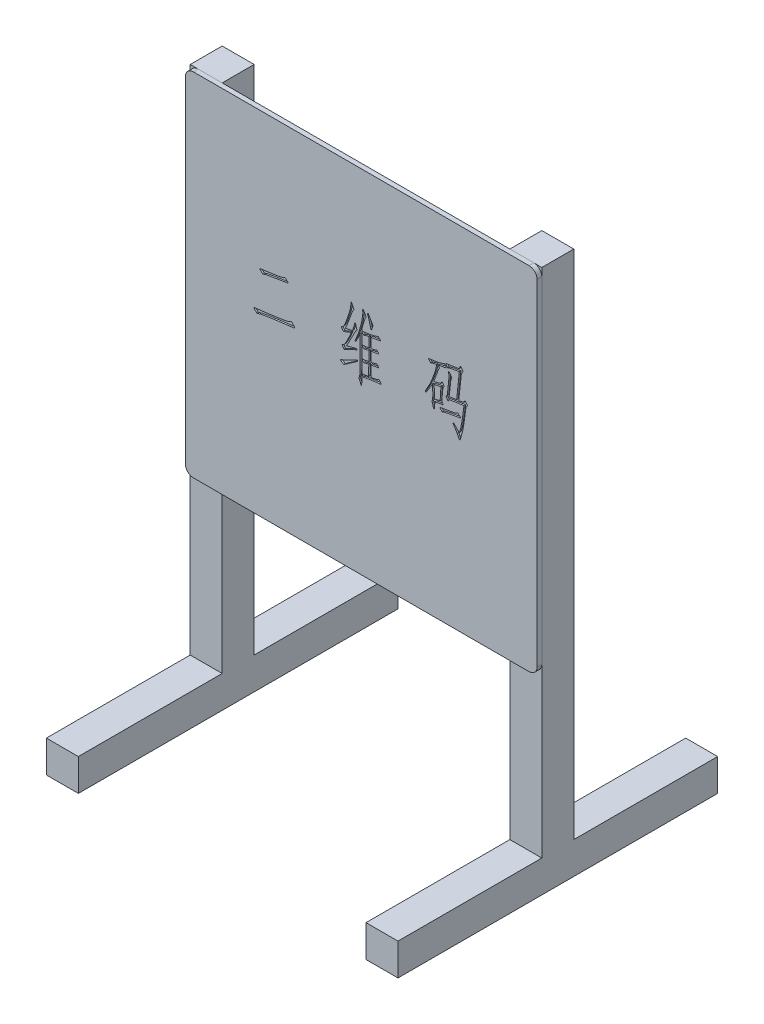
from build123d import *

# Parameters (mm, degrees)
SKETCH_1_W          = 20
SKETCH_1_H          = 20
EXTRUDE_1_DEPTH     = 200
SKETCH_2_W          = 20
SKETCH_2_H          = 20
EXTRUDE_2_DEPTH     = 320
SKETCH_3_W          = 220
SKETCH_3_H          = 220
EXTRUDE_3_DEPTH     = 3
FILLET_1_R          = 5
CUT_EXTRUDE_START   = 112
CUT_EXTRUDE_1_DEPTH = 2


with BuildPart() as part:
    # 草图1 → 凸台-拉伸1 (new body)
    with BuildSketch(Plane.XY):
        with Locations((10, 10)):
            Rectangle(SKETCH_1_W, SKETCH_1_H)
    extrude(amount=EXTRUDE_1_DEPTH)

    # 草图2 → 凸台-拉伸2 (add)
    with BuildSketch(Plane(origin=(0, 20, 0), x_dir=(1, 0, 0), z_dir=(0, 1, 0))):
        with Locations((10, -100)):
            Rectangle(SKETCH_2_W, SKETCH_2_H)
    extrude(amount=EXTRUDE_2_DEPTH)


with BuildPart() as body_2:
    # 草图3 → 凸台-拉伸3 (new body)
    with BuildSketch(Plane.XY.offset(110)):
        with Locations((110, 230)):
            Rectangle(SKETCH_3_W, SKETCH_3_H)
    extrude(amount=EXTRUDE_3_DEPTH)

    # 圆角1
    fillet_1_edges = [body_2.edges().sort_by_distance(p)[0] for p in [
        (0, 340, 111.5),
        (220, 340, 111.5),
        (220, 120, 111.5),
        (0, 120, 111.5),
    ]]
    fillet(fillet_1_edges, radius=FILLET_1_R)

    # 切除-拉伸1: read off the stored shape, not the designer's step
    # 切除-拉伸1 outline → 切除-拉伸1 (cut)
    # profile 1 of 9: a face of its own
    with BuildSketch(Plane.XY.offset(CUT_EXTRUDE_START)):
        with BuildLine():
            Line((55.311740891, 231.09833795), (65.008310249, 232.372150011))
            Line((65.008310249, 232.372150011), (68.121350948, 232.677604944))
            add(Edge.make_bspline(
                [(68.205838483, 233.379501385), (68.267214298, 233.298947041), (68.377007719, 233.154845703), (68.403497912, 232.910428774), (68.31595679, 232.701907335), (68.186205936, 232.685704039), (68.121350948, 232.677604944)],
                knots=[0, 0, 0, 0, 0.331218851, 0.592507827, 0.796318106, 1, 1, 1, 1], degree=3))
            Line((68.205838483, 233.379501385), (66.366609844, 235.264223311))
            add(Edge.make_bspline(
                [(53.953441296, 232.677604944), (54.546980826, 232.762364019), (55.673401803, 232.923220029), (57.27083702, 233.147092374), (58.682460929, 233.358592857), (59.91166994, 233.536917513), (60.955123106, 233.701872794), (61.814141641, 233.833887479), (62.484785098, 233.954036036), (63.141500558, 234.069450651), (63.848011705, 234.25340025), (64.67429026, 234.518041943), (65.51977604, 234.857954636), (66.079951533, 235.126698933), (66.366609844, 235.264223311)],
                knots=[0, 0, 0, 0, 0.141194071, 0.267958501, 0.379861519, 0.477335063, 0.560455941, 0.628644591, 0.681987937, 0.720911212, 0.785623776, 0.85370738, 0.925137754, 1, 1, 1, 1], degree=3))
            Line((53.953441296, 232.677604944), (46.75900277, 231.754741104))
            Line((46.75900277, 231.754741104), (44.73780098, 231.533773706))
            Line((44.73780098, 231.533773706), (43.113040699, 231.403792883))
            add(Edge.make_bspline(
                [(43.028553164, 230.747389729), (42.967212626, 230.813676422), (42.859052635, 230.930557824), (42.829990469, 231.159844066), (42.933016465, 231.339482502), (43.052135883, 231.382035746), (43.113040699, 231.403792883)],
                knots=[0, 0, 0, 0, 0.316797043, 0.558599032, 0.774315177, 1, 1, 1, 1], degree=3))
            Line((43.028553164, 230.747389729), (44.783294268, 229.07713616))
            add(Edge.make_bspline(
                [(55.311740891, 231.09833795), (54.674596678, 231.01339186), (53.455581601, 230.850868897), (51.713596986, 230.591265001), (50.142896385, 230.332618995), (48.741559365, 230.077119462), (47.50775402, 229.839217711), (46.447574029, 229.581951246), (45.553811758, 229.343216478), (45.022949765, 229.159895619), (44.783294268, 229.07713616)],
                knots=[0, 0, 0, 0, 0.179604664, 0.343628318, 0.492104165, 0.624372522, 0.741661642, 0.843114277, 0.929174576, 1, 1, 1, 1], degree=3))
        make_face()
    # profile 2 of 9: a face of its own
    with BuildSketch(Plane.XY.offset(CUT_EXTRUDE_START)):
        with BuildLine():
            Line((114.289367143, 263.821010015), (113.892925634, 263.431067547))
            Line((113.892925634, 263.431067547), (114.419347965, 261.981781377))
            Line((114.419347965, 261.981781377), (114.945770296, 260.181546985))
            Line((114.945770296, 260.181546985), (115.426699339, 258.556786704))
            Line((115.426699339, 258.556786704), (115.823140848, 256.97751971))
            Line((115.823140848, 256.97751971), (116.083102493, 255.794694225))
            add(Edge.make_bspline(
                [(116.655018112, 256.275623269), (116.626591021, 256.193711957), (116.57621048, 256.048542823), (116.514130688, 255.855343264), (116.440952703, 255.739312778), (116.365295868, 255.640031707), (116.209893934, 255.679096068), (116.131492965, 255.750575716), (116.083102493, 255.794694225)],
                knots=[0, 0, 0, 0, 0.259257877, 0.459475505, 0.595649689, 0.677811931, 0.801139795, 1, 1, 1, 1], degree=3))
            Line((116.655018112, 256.275623269), (117.181440443, 257.90038355))
            add(Edge.make_bspline(
                [(116.921478798, 259.525143831), (116.97721778, 259.412250092), (117.075832903, 259.212515015), (117.211720192, 258.954822778), (117.290407409, 258.765692505), (117.336757043, 258.628544429), (117.332950654, 258.501162233), (117.300361051, 258.348486155), (117.259222879, 258.140249036), (117.209375722, 257.986530365), (117.181440443, 257.90038355)],
                knots=[0, 0, 0, 0, 0.217917052, 0.385545554, 0.503184461, 0.573208245, 0.633180841, 0.720685488, 0.843466929, 1, 1, 1, 1], degree=3))
            Line((116.921478798, 259.525143831), (116.083102493, 260.928936714))
            Line((116.083102493, 260.928936714), (115.60217345, 261.676326444))
            Line((115.60217345, 261.676326444), (114.991263584, 262.729171106))
            Line((114.991263584, 262.729171106), (114.289367143, 263.821010015))
        make_face()
    # profile 3 of 9: a face of its own
    with BuildSketch(Plane.XY.offset(CUT_EXTRUDE_START)):
        with BuildLine():
            Line((150.799808225, 240.970381419), (150.058917537, 239.781056893))
            Line((150.058917537, 239.781056893), (150.448860004, 239.079160452))
            Line((150.448860004, 239.079160452), (151.066268911, 239.956531004))
            add(Edge.make_bspline(
                [(154.660238653, 245.88365651), (154.487187195, 245.573727115), (154.151439176, 244.9724136), (153.656224015, 244.09542135), (153.176565286, 243.276104254), (152.721824028, 242.504300253), (152.282228948, 241.791221307), (151.854171496, 241.135475615), (151.464910258, 240.521153723), (151.195571884, 240.139671556), (151.066268911, 239.956531004)],
                knots=[0, 0, 0, 0, 0.153559991, 0.297931398, 0.435681254, 0.564260234, 0.685455066, 0.798015817, 0.903032178, 1, 1, 1, 1], degree=3))
            Line((154.660238653, 245.88365651), (154.796718517, 239.605582783))
            Line((154.796718517, 239.605582783), (154.705731941, 238.422757298))
            add(Edge.make_bspline(
                [(154.621244407, 237.285425101), (154.628277552, 237.330858335), (154.647287712, 237.453661578), (154.661235041, 237.690677956), (154.691811182, 238.023644268), (154.700741333, 238.279674815), (154.705731941, 238.422757298)],
                knots=[0, 0, 0, 0, 0.120831814, 0.326600979, 0.623671454, 1, 1, 1, 1], degree=3))
            add(Edge.make_bspline(
                [(154.484764543, 235.48519071), (154.459275346, 235.561191717), (154.414832084, 235.693707963), (154.35347763, 235.857369087), (154.325668643, 235.961277749), (154.276050181, 236.02194154), (154.329326297, 236.148959212), (154.363387198, 236.380732888), (154.493304599, 236.780744662), (154.574057344, 237.099287669), (154.621244407, 237.285425101)],
                knots=[0, 0, 0, 0, 0.12798716, 0.22315991, 0.279043581, 0.299213499, 0.341295418, 0.473014495, 0.692061271, 1, 1, 1, 1], degree=3))
            Line((154.484764543, 235.48519071), (154.796718517, 234.432346047))
            Line((154.796718517, 234.432346047), (155.10217345, 233.424994673))
            add(Edge.make_bspline(
                [(155.979544002, 234.126891114), (155.970745125, 233.990082684), (155.954049492, 233.730492352), (155.899678091, 233.370330383), (155.809877602, 233.053076565), (155.725016723, 232.825679699), (155.583882529, 232.61502931), (155.361969527, 232.742171498), (155.249335565, 233.030912036), (155.158072727, 233.275303057), (155.10217345, 233.424994673)],
                knots=[0, 0, 0, 0, 0.164724541, 0.312560405, 0.439664693, 0.552949131, 0.626671498, 0.686222562, 0.807808604, 1, 1, 1, 1], degree=3))
            Line((155.979544002, 234.126891114), (156.02503729, 236.713509482))
            Line((156.02503729, 236.713509482), (158.085233326, 237.148945238))
            Line((158.085233326, 237.148945238), (159.313552099, 237.369912636))
            Line((159.313552099, 237.369912636), (161.068293203, 237.545386746))
            add(Edge.make_bspline(
                [(160.977306627, 238.422757298), (161.02722108, 238.342752282), (161.116642085, 238.199424475), (161.234298611, 238.007109549), (161.294322264, 237.850685838), (161.323183605, 237.708930078), (161.244013879, 237.560650399), (161.129999054, 237.550746711), (161.068293203, 237.545386746)],
                knots=[0, 0, 0, 0, 0.255446758, 0.457629097, 0.60792079, 0.708286671, 0.842122117, 1, 1, 1, 1], degree=3))
            Line((160.977306627, 238.422757298), (160.411890049, 239.170147027))
            Line((160.411890049, 239.170147027), (160.892819092, 244.78531856))
            add(Edge.make_bspline(
                [(161.854677179, 247.768378436), (161.809437285, 247.705356037), (161.687372442, 247.535311002), (161.463274178, 247.244273819), (161.219153955, 246.849954387), (161.093335715, 246.433914945), (161.032693892, 246.046674047), (160.977198574, 245.685443756), (160.935872073, 245.257792927), (160.907822165, 244.949966095), (160.892819092, 244.78531856)],
                knots=[0, 0, 0, 0, 0.072571315, 0.195809616, 0.343894341, 0.503501307, 0.598135749, 0.710785421, 0.845307612, 1, 1, 1, 1], degree=3))
            add(Edge.make_bspline(
                [(161.594715534, 248.554762412), (161.652041232, 248.460413938), (161.738979709, 248.317327803), (161.832789926, 248.141760547), (161.854413177, 248.025895682), (161.874830472, 247.940897364), (161.888283613, 247.85059167), (161.866036066, 247.796166296), (161.854677179, 247.768378436)],
                knots=[0, 0, 0, 0, 0.387744208, 0.58804152, 0.68926208, 0.797888549, 0.89680834, 1, 1, 1, 1], degree=3))
            Line((161.594715534, 248.554762412), (160.93831238, 249.477626252))
            add(Edge.make_bspline(
                [(160.411890049, 249.744086938), (160.437049902, 249.777273047), (160.48655251, 249.842567505), (160.641719316, 249.809086694), (160.78020369, 249.672524329), (160.879202957, 249.550489501), (160.93831238, 249.477626252)],
                knots=[0, 0, 0, 0, 0.164891866, 0.324428664, 0.596637099, 1, 1, 1, 1], degree=3))
            Line((160.411890049, 249.744086938), (160.320903473, 249.52311954))
            Line((160.320903473, 249.52311954), (159.748987854, 248.515768165))
            Line((159.748987854, 248.515768165), (155.674089069, 247.462923503))
            Line((155.674089069, 247.462923503), (155.537609205, 247.989345834))
            Line((155.537609205, 247.989345834), (156.414979757, 250.270509269))
            Line((156.414979757, 250.270509269), (157.207862774, 252.330705306))
            add(Edge.make_bspline(
                [(159.008097166, 256.451097379), (158.927387796, 256.334500563), (158.776226942, 256.116125992), (158.571942522, 255.803447186), (158.410493144, 255.525202694), (158.276381711, 255.270898906), (158.169135914, 255.005022258), (158.05154876, 254.703337795), (157.915468076, 254.348674948), (157.719855442, 253.812358195), (157.489991453, 253.131320261), (157.299402349, 252.590473129), (157.207862774, 252.330705306)],
                knots=[0, 0, 0, 0, 0.094159034, 0.176350774, 0.24789695, 0.307725659, 0.367033354, 0.438086202, 0.522770104, 0.619240999, 0.817122194, 1, 1, 1, 1], degree=3))
            Line((159.008097166, 256.451097379), (158.345194971, 257.770402727))
            Line((158.345194971, 257.770402727), (160.93831238, 258.251331771))
            Line((160.93831238, 258.251331771), (162.998508417, 258.517792457))
            add(Edge.make_bspline(
                [(162.868527594, 259.258683145), (162.912955633, 259.200870255), (162.991863464, 259.098189836), (163.081913209, 258.954740265), (163.143190388, 258.848152973), (163.154732494, 258.739317828), (163.101704312, 258.625737173), (163.035662381, 258.556656155), (162.998508417, 258.517792457)],
                knots=[0, 0, 0, 0, 0.251381504, 0.446474109, 0.587037978, 0.669673403, 0.814164392, 1, 1, 1, 1], degree=3))
            Line((162.868527594, 259.258683145), (161.900170467, 260.402514383))
            add(Edge.make_bspline(
                [(156.856914554, 258.953228212), (157.30873011, 259.027249075), (158.198842292, 259.173075995), (159.493431515, 259.494149496), (160.730138917, 259.892219669), (161.512749069, 260.233545357), (161.900170467, 260.402514383)],
                knots=[0, 0, 0, 0, 0.260783077, 0.513763171, 0.759294521, 1, 1, 1, 1], degree=3))
            Line((156.856914554, 258.953228212), (154.796718517, 258.647773279))
            Line((154.796718517, 258.647773279), (153.392925634, 258.472299169))
            Line((153.392925634, 258.472299169), (152.164606861, 258.381312593))
            add(Edge.make_bspline(
                [(152.340080972, 257.770402727), (152.259611529, 257.837983458), (152.136984252, 257.940969643), (152.005561587, 258.122253887), (152.059206803, 258.277260967), (152.126308682, 258.34350438), (152.164606861, 258.381312593)],
                knots=[0, 0, 0, 0, 0.416181551, 0.634218514, 0.791231403, 1, 1, 1, 1], degree=3))
            Line((152.340080972, 257.770402727), (152.996484125, 257.068506286))
            add(Edge.make_bspline(
                [(153.522906456, 256.587577243), (153.500744507, 256.597626845), (153.434928578, 256.627471869), (153.329613885, 256.728608814), (153.172910159, 256.874146944), (153.060456623, 256.998031128), (152.996484125, 257.068506286)],
                knots=[0, 0, 0, 0, 0.101355639, 0.301003095, 0.602355075, 1, 1, 1, 1], degree=3))
            Line((153.522906456, 256.587577243), (154.270296186, 256.847538888))
            Line((154.270296186, 256.847538888), (154.835712764, 257.023012998))
            Line((154.835712764, 257.023012998), (155.583102493, 257.198487108))
            Line((155.583102493, 257.198487108), (157.207862774, 257.503942041))
            add(Edge.make_bspline(
                [(150.799808225, 240.970381419), (151.188914469, 241.619198951), (151.942930272, 242.876487109), (152.946199517, 244.757278722), (153.79628758, 246.560683661), (154.375065751, 248.024984496), (154.77873609, 249.134016174), (155.049662109, 249.905357735), (155.312470971, 250.622026387), (155.54310401, 251.291217866), (155.759668882, 251.905704736), (155.957900201, 252.469341364), (156.119915707, 252.988690515), (156.338736204, 253.612765077), (156.568517317, 254.394313075), (156.81811531, 255.37106409), (157.029164466, 256.415247748), (157.147348239, 257.135265752), (157.207862774, 257.503942041)],
                knots=[0, 0, 0, 0, 0.12725998, 0.246606261, 0.358453465, 0.462472167, 0.511357242, 0.557005095, 0.600005424, 0.639770449, 0.676078407, 0.709617602, 0.74027466, 0.767588878, 0.820858284, 0.877252545, 0.937148688, 1, 1, 1, 1], degree=3))
        make_face()
        Polygon((157.428830173, 238.513743874), (155.888557426, 238.162795653), (155.628595781, 245.922650756), (159.885467718, 246.845514596), (159.359045387, 238.994672917), (158.962603878, 238.864692095), (158.345194971, 238.728212231), align=None, mode=Mode.SUBTRACT)
    # profile 4 of 9: a face of its own
    with BuildSketch(Plane.XY.offset(CUT_EXTRUDE_START)):
        with BuildLine():
            Line((174.137864905, 245.441721713), (170.979330918, 244.869806094))
            Line((170.979330918, 244.869806094), (172.519603665, 258.732260814))
            add(Edge.make_bspline(
                [(173.305987641, 262.592691242), (173.372516065, 262.509390848), (173.48667615, 262.36645074), (173.615033216, 262.17064053), (173.70252746, 262.051379021), (173.73303579, 261.945296898), (173.667366768, 261.853745081), (173.602091716, 261.70339843), (173.441362472, 261.474276344), (173.231538189, 261.153114283), (172.981217659, 260.78224873), (172.796763627, 260.436242643), (172.675251125, 260.10375241), (172.626296893, 259.741998961), (172.552811588, 259.276046585), (172.531403628, 258.925487348), (172.519603665, 258.732260814)],
                knots=[0, 0, 0, 0, 0.074732564, 0.128238057, 0.163663227, 0.179152433, 0.200898935, 0.236905413, 0.296315228, 0.394887931, 0.506953331, 0.609528566, 0.669093498, 0.753999325, 0.864405634, 1, 1, 1, 1], degree=3))
            Line((173.305987641, 262.592691242), (172.6040912, 263.56104837))
            add(Edge.make_bspline(
                [(171.817707224, 263.56104837), (171.844471369, 263.618252591), (171.892431955, 263.720760929), (171.972285322, 263.84299903), (172.053202534, 263.924145054), (172.193579422, 263.944250482), (172.387561882, 263.794533304), (172.520372174, 263.651323126), (172.6040912, 263.56104837)],
                knots=[0, 0, 0, 0, 0.16914341, 0.303100178, 0.393991336, 0.464779001, 0.662615147, 1, 1, 1, 1], degree=3))
            Line((171.817707224, 263.56104837), (171.154805029, 262.202748775))
            Line((171.154805029, 262.202748775), (165.630620072, 261.409865758))
            Line((165.630620072, 261.409865758), (163.173982527, 261.104410825))
            add(Edge.make_bspline(
                [(163.082995951, 260.487001918), (163.036112019, 260.546185743), (162.954990685, 260.648589077), (162.913087697, 260.839080759), (163.005332847, 261.006399591), (163.112961921, 261.068948529), (163.173982527, 261.104410825)],
                knots=[0, 0, 0, 0, 0.296863927, 0.513651413, 0.724263301, 1, 1, 1, 1], degree=3))
            Line((163.082995951, 260.487001918), (163.875878969, 259.479650543))
            add(Edge.make_bspline(
                [(164.135840614, 259.17419561), (164.106998895, 259.199570069), (164.006094357, 259.288344184), (163.930130176, 259.399947206), (163.875878969, 259.479650543)],
                knots=[0, 0, 0, 0, 0.285831731, 1, 1, 1, 1], degree=3))
            Line((164.135840614, 259.17419561), (164.837737055, 259.434157255))
            Line((164.837737055, 259.434157255), (165.234178564, 259.570637119))
            Line((165.234178564, 259.570637119), (166.066055828, 259.785105476))
            Line((166.066055828, 259.785105476), (167.164393778, 260.006072874))
            Line((167.164393778, 260.006072874), (168.613679949, 260.227040273))
            Line((168.613679949, 260.227040273), (171.375772427, 260.707969316))
            Line((171.375772427, 260.707969316), (169.712017899, 244.739825272))
            Line((169.712017899, 244.739825272), (165.013211166, 243.992435542))
            Line((165.013211166, 243.992435542), (165.806094183, 251.056893245))
            add(Edge.make_bspline(
                [(166.767952269, 255.092797784), (166.67683976, 254.940373556), (166.507178376, 254.656543097), (166.29338829, 254.219257207), (166.157644027, 253.742953141), (166.053907586, 253.29323944), (165.979362549, 252.830153393), (165.923165113, 252.348711466), (165.866841443, 251.743813279), (165.827552588, 251.299541361), (165.806094183, 251.056893245)],
                knots=[0, 0, 0, 0, 0.126892964, 0.236288475, 0.346436829, 0.47972832, 0.56598426, 0.681358403, 0.825967431, 1, 1, 1, 1], degree=3))
            Line((166.767952269, 255.092797784), (164.837737055, 257.679416152))
            Line((164.837737055, 257.679416152), (164.532282122, 257.243980396))
            add(Edge.make_bspline(
                [(164.798742808, 253.559024078), (164.8209725, 253.877303628), (164.862683396, 254.474510538), (164.850319633, 255.212762969), (164.809399495, 255.783346345), (164.740923162, 256.236067824), (164.649184075, 256.727978962), (164.572471259, 257.066586849), (164.532282122, 257.243980396)],
                knots=[0, 0, 0, 0, 0.257649609, 0.483443337, 0.595792872, 0.719545655, 0.853072557, 1, 1, 1, 1], degree=3))
            Line((164.798742808, 253.559024078), (164.4023013, 249.432132964))
            Line((164.4023013, 249.432132964), (163.921372257, 244.869806094))
            add(Edge.make_bspline(
                [(163.044001705, 243.466013211), (163.073528906, 243.48922056), (163.1824122, 243.574799027), (163.397203842, 243.609079598), (163.613673523, 243.778425316), (163.748640862, 244.045105298), (163.854228536, 244.417559137), (163.89712257, 244.706472174), (163.921372257, 244.869806094)],
                knots=[0, 0, 0, 0, 0.062608713, 0.230873317, 0.350243279, 0.510030643, 0.723001024, 1, 1, 1, 1], degree=3))
            add(Edge.make_bspline(
                [(163.30396335, 242.679629235), (163.257778959, 242.739744178), (163.176458733, 242.845592944), (163.078637128, 242.990442691), (163.011584074, 243.094704726), (162.958090997, 243.193992617), (162.974901569, 243.326744192), (163.019057534, 243.415739066), (163.044001705, 243.466013211)],
                knots=[0, 0, 0, 0, 0.252519702, 0.444629865, 0.580759357, 0.667936705, 0.812413936, 1, 1, 1, 1], degree=3))
            Line((163.30396335, 242.679629235), (163.921372257, 241.847751971))
            add(Edge.make_bspline(
                [(164.623268698, 241.756765395), (164.576848485, 241.680868081), (164.503606082, 241.561116334), (164.371182782, 241.405043996), (164.251887656, 241.448340922), (164.168611375, 241.536008169), (164.046283982, 241.666823498), (163.96724052, 241.781314054), (163.921372257, 241.847751971)],
                knots=[0, 0, 0, 0, 0.268311094, 0.423344653, 0.488088568, 0.602435671, 0.769296728, 1, 1, 1, 1], degree=3))
            Line((164.623268698, 241.756765395), (164.974216919, 242.374174302))
            add(Edge.make_bspline(
                [(170.147453654, 243.206051566), (169.683987073, 243.127263014), (168.779169386, 242.973445505), (167.452561109, 242.761689184), (166.19255541, 242.557190244), (165.372943743, 242.434070108), (164.974216919, 242.374174302)],
                knots=[0, 0, 0, 0, 0.26915979, 0.525475944, 0.769152298, 1, 1, 1, 1], degree=3))
            Line((170.147453654, 243.206051566), (174.274344769, 243.777967185))
            add(Edge.make_bspline(
                [(170.452908587, 228.550713829), (170.575911447, 228.429570738), (170.789759123, 228.218956377), (171.09043021, 227.975555143), (171.289148775, 227.841137321), (171.464087154, 227.801549537), (171.533546384, 227.915182893), (171.585961908, 228.051272254), (171.65786434, 228.261750311), (171.741908996, 228.542717991), (171.836283741, 228.897084211), (171.95050286, 229.322297774), (172.063219603, 229.822223823), (172.327157135, 230.97357253), (172.693639408, 232.725378901), (173.010471716, 234.504231263), (173.218648094, 235.73525382), (173.323708742, 236.499307047), (173.458296226, 237.39057338), (173.589352511, 238.416611612), (173.75079409, 239.569977664), (173.90690392, 240.858180093), (174.094410186, 242.273722323), (174.212653841, 243.262233861), (174.274344769, 243.777967185)],
                knots=[0, 0, 0, 0, 0.029687112, 0.051612783, 0.065249081, 0.072686524, 0.07744287, 0.085928552, 0.098496207, 0.115180665, 0.136354191, 0.161307738, 0.190677182, 0.224194587, 0.363832717, 0.497442661, 0.533956075, 0.577867145, 0.629656955, 0.68848736, 0.755196246, 0.829318943, 0.910951055, 1, 1, 1, 1], degree=3))
            Line((170.452908587, 228.550713829), (167.736309397, 231.228318773))
            Line((167.736309397, 231.228318773), (167.469848711, 230.656403154))
            Line((167.469848711, 230.656403154), (169.224589815, 227.939803963))
            Line((169.224589815, 227.939803963), (169.971979544, 226.665991903))
            Line((169.971979544, 226.665991903), (170.764862561, 225.26219902))
            Line((170.764862561, 225.26219902), (171.330279139, 223.988386959))
            add(Edge.make_bspline(
                [(175.678137652, 243.602493075), (175.633714849, 243.506135825), (175.526646694, 243.273894901), (175.441859342, 242.848570301), (175.368187961, 242.343440126), (175.288102674, 241.92050423), (175.244650012, 241.557199726), (175.197049051, 241.230654864), (175.140786953, 240.777301003), (175.060969102, 240.203750895), (174.970785271, 239.506074701), (174.865855954, 238.685143908), (174.751736946, 237.739987158), (174.572397463, 236.348819578), (174.340533039, 234.620690417), (174.048770078, 232.659589409), (173.722761057, 230.901024076), (173.436834196, 229.562480697), (173.214959701, 228.590315222), (173.047402272, 227.936211048), (172.905684866, 227.326545248), (172.74990247, 226.772526964), (172.615206609, 226.264576511), (172.488930447, 225.803456308), (172.355767141, 225.396226824), (172.210855123, 224.944803027), (172.04648027, 224.492786255), (171.863859368, 224.086436904), (171.739583118, 223.830529631), (171.555305025, 223.713464775), (171.400272478, 223.831721183), (171.35321519, 223.9370493), (171.330279139, 223.988386959)],
                knots=[0, 0, 0, 0, 0.01529711, 0.036869202, 0.062251082, 0.08922881, 0.099017429, 0.115138619, 0.13693009, 0.165054042, 0.198848377, 0.238624116, 0.28469248, 0.336470994, 0.441392713, 0.53674999, 0.623050292, 0.699888284, 0.734604504, 0.767188787, 0.797494747, 0.825071114, 0.850367846, 0.873467928, 0.894167682, 0.91229075, 0.942016756, 0.963607025, 0.976722649, 0.983024987, 0.99172626, 1, 1, 1, 1], degree=3))
            Line((175.678137652, 243.602493075), (176.24355423, 244.343383763))
            add(Edge.make_bspline(
                [(176.113573407, 245.357234179), (176.162982763, 245.283470911), (176.250796708, 245.152373401), (176.370823975, 244.982226139), (176.422739997, 244.845177794), (176.448164938, 244.725395572), (176.40610182, 244.615173715), (176.360601254, 244.503690207), (176.301873813, 244.413894936), (176.261228841, 244.364753215), (176.24355423, 244.343383763)],
                knots=[0, 0, 0, 0, 0.231424617, 0.411304871, 0.53799865, 0.61215232, 0.722917499, 0.833969264, 0.927800943, 1, 1, 1, 1], degree=3))
            Line((176.113573407, 245.357234179), (175.366183678, 246.364585553))
            add(Edge.make_bspline(
                [(174.664287236, 246.410078841), (174.716481679, 246.475615675), (174.797252415, 246.577033717), (174.870225601, 246.742063519), (174.983646928, 246.739060999), (175.074184985, 246.658587216), (175.211090565, 246.539855876), (175.3090533, 246.429148444), (175.366183678, 246.364585553)],
                knots=[0, 0, 0, 0, 0.25812447, 0.399446799, 0.457200847, 0.56400295, 0.745733149, 1, 1, 1, 1], degree=3))
            Line((174.664287236, 246.410078841), (174.137864905, 245.441721713))
        make_face()
    # profile 5 of 9: a face of its own
    with BuildSketch(Plane.XY.offset(CUT_EXTRUDE_START)):
        with BuildLine():
            add(Edge.make_bspline(
                [(159.398039633, 234.867781803), (159.344978782, 234.923598395), (159.258299807, 235.014779086), (159.200133278, 235.188772934), (159.292490476, 235.334235057), (159.456474674, 235.37527999), (159.653495681, 235.411288337), (159.901693994, 235.468579515), (160.23866413, 235.521106398), (160.662869629, 235.595552308), (161.177158807, 235.676845995), (161.778020683, 235.784841622), (162.469920876, 235.892490146), (162.959539865, 235.970302763), (163.219475815, 236.011613041)],
                knots=[0, 0, 0, 0, 0.051357777, 0.083896873, 0.112342885, 0.154391922, 0.191162738, 0.247170376, 0.323283437, 0.418363936, 0.533835648, 0.669937348, 0.824771606, 1, 1, 1, 1], degree=3))
            Line((159.398039633, 234.867781803), (160.320903473, 233.990411251))
            add(Edge.make_bspline(
                [(160.717344982, 233.63946303), (160.708528904, 233.645789401), (160.672283631, 233.67179882), (160.609115287, 233.748572703), (160.474875333, 233.847030979), (160.378193147, 233.937062483), (160.320903473, 233.990411251)],
                knots=[0, 0, 0, 0, 0.061334177, 0.252161352, 0.556863223, 1, 1, 1, 1], degree=3))
            Line((160.717344982, 233.63946303), (161.328254848, 233.860430428))
            Line((161.328254848, 233.860430428), (162.472086086, 234.165885361))
            Line((162.472086086, 234.165885361), (163.700404858, 234.477839335))
            Line((163.700404858, 234.477839335), (165.851587471, 234.867781803))
            Line((165.851587471, 234.867781803), (171.596739825, 235.881632218))
            add(Edge.make_bspline(
                [(171.772213936, 236.622522906), (171.850555503, 236.537171795), (171.977869395, 236.398466601), (172.102051307, 236.186367794), (172.050220532, 236.045307009), (171.94301624, 235.978414149), (171.792892733, 235.916445006), (171.666951628, 235.894093255), (171.596739825, 235.881632218)],
                knots=[0, 0, 0, 0, 0.307258493, 0.499329741, 0.577608116, 0.669783951, 0.815905506, 1, 1, 1, 1], degree=3))
            Line((171.772213936, 236.622522906), (170.452908587, 237.850841679))
            add(Edge.make_bspline(
                [(165.539633497, 236.362561261), (165.819327308, 236.404378331), (166.358307679, 236.48496138), (167.13310979, 236.625665903), (167.841432534, 236.789149721), (168.488722929, 236.962998481), (169.073821614, 237.155222299), (169.593727718, 237.370652705), (170.053094391, 237.59377486), (170.324361065, 237.76819003), (170.452908587, 237.850841679)],
                knots=[0, 0, 0, 0, 0.163962559, 0.315961946, 0.456423141, 0.5853108, 0.704467482, 0.813162357, 0.911461605, 1, 1, 1, 1], degree=3))
            Line((165.539633497, 236.362561261), (163.219475815, 236.011613041))
        make_face()
    # profile 6 of 9: a face of its own
    with BuildSketch(Plane.XY.offset(CUT_EXTRUDE_START)):
        with BuildLine():
            Line((57.020988707, 253.955465587), (61.628808864, 254.657362029))
            Line((61.628808864, 254.657362029), (63.994459834, 255.047304496))
            add(Edge.make_bspline(
                [(63.994459834, 255.710206691), (64.04582105, 255.638944348), (64.141757571, 255.505834939), (64.157772747, 255.291944937), (64.13518608, 255.097309716), (64.036471749, 255.062232877), (63.994459834, 255.047304496)],
                knots=[0, 0, 0, 0, 0.33182184, 0.619802934, 0.838191611, 1, 1, 1, 1], degree=3))
            Line((63.994459834, 255.710206691), (62.330705306, 257.243980396))
            add(Edge.make_bspline(
                [(57.67739186, 255.794694225), (58.127356631, 255.867419314), (58.993048831, 256.007335917), (60.221345776, 256.329238628), (61.336299352, 256.72038316), (62.007138957, 257.073608884), (62.330705306, 257.243980396)],
                knots=[0, 0, 0, 0, 0.278844559, 0.536472133, 0.776426408, 1, 1, 1, 1], degree=3))
            Line((57.67739186, 255.794694225), (54.609844449, 255.35925847))
            Line((54.609844449, 255.35925847), (50.482953335, 254.741849563))
            Line((50.482953335, 254.741849563), (48.552738121, 254.481887918))
            Line((48.552738121, 254.481887918), (46.843490305, 254.26092052))
            add(Edge.make_bspline(
                [(46.75900277, 253.643511613), (46.69662457, 253.689575697), (46.579178376, 253.776305539), (46.535353284, 253.994868175), (46.629309185, 254.20064775), (46.769147443, 254.239999674), (46.843490305, 254.26092052)],
                knots=[0, 0, 0, 0, 0.268166847, 0.504906772, 0.736791288, 1, 1, 1, 1], degree=3))
            Line((46.75900277, 253.643511613), (48.468250586, 252.155231195))
            add(Edge.make_bspline(
                [(57.020988707, 253.955465587), (56.750132564, 253.910344883), (56.225632246, 253.822970738), (55.463972995, 253.689823532), (54.750418362, 253.575630075), (54.085452775, 253.464516086), (53.468665492, 253.358936198), (52.898833984, 253.268294205), (52.37630591, 253.190887965), (51.748942751, 253.097481248), (51.00253203, 252.974012239), (50.138073319, 252.75410936), (49.288607986, 252.492829469), (48.74182061, 252.267812331), (48.468250586, 252.155231195)],
                knots=[0, 0, 0, 0, 0.094000391, 0.182027383, 0.264689496, 0.34137717, 0.412822387, 0.478904821, 0.538897386, 0.593646113, 0.696063549, 0.797688523, 0.898779017, 1, 1, 1, 1], degree=3))
        make_face()
    # profile 7 of 9: a face of its own
    with BuildSketch(Plane.XY.offset(CUT_EXTRUDE_START)):
        with BuildLine():
            Line((107.751331771, 234.477839335), (107.530364372, 235.134242489))
            Line((107.530364372, 235.134242489), (105.470168336, 234.035904539))
            Line((105.470168336, 234.035904539), (103.364479011, 232.937566589))
            Line((103.364479011, 232.937566589), (101.518751332, 232.02120179))
            Line((101.518751332, 232.02120179), (98.932132964, 230.877370552))
            Line((98.932132964, 230.877370552), (97.047411038, 230.17547411))
            add(Edge.make_bspline(
                [(97.307372683, 229.564564245), (97.251122233, 229.599167711), (97.152453218, 229.659865714), (97.022892134, 229.739714503), (96.94822641, 229.816367484), (96.900112305, 229.910602742), (96.954707422, 230.040508558), (97.013433929, 230.126007439), (97.047411038, 230.17547411)],
                knots=[0, 0, 0, 0, 0.237400704, 0.416425003, 0.543014299, 0.619602155, 0.779915071, 1, 1, 1, 1], degree=3))
            Line((97.307372683, 229.564564245), (99.062113786, 228.420733007))
            add(Edge.make_bspline(
                [(107.751331771, 234.477839335), (107.491917514, 234.292917859), (106.924234888, 233.888249625), (105.984091608, 233.24558323), (104.88998261, 232.506980396), (103.675580825, 231.702905502), (102.431091042, 230.861656312), (101.225416291, 230.035991141), (100.115362409, 229.219589221), (99.405938711, 228.681513483), (99.062113786, 228.420733007)],
                knots=[0, 0, 0, 0, 0.090212571, 0.197414397, 0.322472287, 0.464032319, 0.609848439, 0.747855999, 0.87779744, 1, 1, 1, 1], degree=3))
        make_face()
    # profile 8 of 9: a face of its own
    with BuildSketch(Plane.XY.offset(CUT_EXTRUDE_START)):
        with BuildLine():
            Line((106.873961219, 246.670040486), (106.081078202, 244.915299382))
            Line((106.081078202, 244.915299382), (106.47751971, 244.479863627))
            Line((106.47751971, 244.479863627), (107.094928617, 245.441721713))
            add(Edge.make_bspline(
                [(109.376092052, 250.44598338), (109.261244972, 250.186036346), (109.034306732, 249.672380082), (108.748264468, 249.023703453), (108.501043001, 248.482008379), (108.296347631, 248.013798), (108.052008048, 247.484786103), (107.795518829, 246.924102262), (107.557923706, 246.393192052), (107.355181511, 245.962650398), (107.208648107, 245.658889929), (107.125494551, 245.500092969), (107.094928617, 245.441721713)],
                knots=[0, 0, 0, 0, 0.155005948, 0.306292305, 0.386675862, 0.479775159, 0.584997301, 0.704496751, 0.816075099, 0.902234739, 0.964063034, 1, 1, 1, 1], degree=3))
            Line((109.376092052, 250.44598338), (109.376092052, 230.480929043))
            add(Edge.make_bspline(
                [(108.804176433, 225.43767313), (108.744568311, 225.562272231), (108.648253918, 225.763598601), (108.584563772, 226.032586895), (108.633355799, 226.216892198), (108.683618342, 226.393321162), (108.772615613, 226.618107937), (108.878560684, 226.899535109), (108.992027532, 227.248992987), (109.093000476, 227.672317144), (109.176110379, 228.174188668), (109.241183209, 228.723377007), (109.295026492, 229.267659497), (109.343079224, 229.75032865), (109.371880678, 230.144782753), (109.374816019, 230.379077809), (109.376092052, 230.480929043)],
                knots=[0, 0, 0, 0, 0.080539185, 0.130134661, 0.154539078, 0.189933462, 0.236861148, 0.294527677, 0.364485851, 0.449843493, 0.54675463, 0.659469131, 0.770652526, 0.864077696, 0.940912734, 1, 1, 1, 1], degree=3))
            Line((108.804176433, 225.43767313), (109.415086299, 223.949392713))
            add(Edge.make_bspline(
                [(110.428936714, 225.743128063), (110.426989411, 225.6716303), (110.422385294, 225.50258412), (110.407949019, 225.208008022), (110.390527636, 224.832960532), (110.356985753, 224.404349465), (110.325733331, 223.971161855), (110.301347821, 223.580916431), (110.276385619, 223.258103983), (110.250069383, 223.004271714), (110.227889233, 222.816226341), (110.194184674, 222.684979733), (110.116246507, 222.612210411), (109.998754994, 222.626751988), (109.90129426, 222.790958425), (109.769633065, 223.044724416), (109.591693402, 223.448163172), (109.479423326, 223.76679746), (109.415086299, 223.949392713)],
                knots=[0, 0, 0, 0, 0.045545766, 0.107686416, 0.187806784, 0.284620722, 0.381434659, 0.464390884, 0.533588333, 0.587672693, 0.626692019, 0.654625605, 0.672292356, 0.688904235, 0.722127994, 0.78445213, 0.876479026, 1, 1, 1, 1], degree=3))
            Line((110.428936714, 225.743128063), (110.513424249, 228.90166205))
            Line((110.513424249, 228.90166205), (111.520775623, 227.63434903))
            add(Edge.make_bspline(
                [(114.640315363, 228.336245472), (114.317192682, 228.284007694), (113.710531161, 228.185931478), (112.866098628, 228.020167251), (112.147108576, 227.842134516), (111.717213789, 227.699517244), (111.520775623, 227.63434903)],
                knots=[0, 0, 0, 0, 0.306658595, 0.575750267, 0.806141312, 1, 1, 1, 1], degree=3))
            Line((114.640315363, 228.336245472), (117.311421266, 228.726187939))
            Line((117.311421266, 228.726187939), (119.41711059, 229.038141913))
            Line((119.41711059, 229.038141913), (121.392819092, 229.252610271))
            Line((121.392819092, 229.252610271), (122.400170467, 229.298103558))
            add(Edge.make_bspline(
                [(122.445663755, 229.870019177), (122.480440408, 229.815757638), (122.545125892, 229.714829755), (122.53951536, 229.54163556), (122.48752937, 229.402554902), (122.428137753, 229.331542859), (122.400170467, 229.298103558)],
                knots=[0, 0, 0, 0, 0.301103748, 0.560060845, 0.792834323, 1, 1, 1, 1], degree=3))
            Line((122.445663755, 229.870019177), (121.132857447, 231.228318773))
            add(Edge.make_bspline(
                [(115.998614958, 230), (116.291422497, 230.032096321), (116.854427017, 230.093810488), (117.663218084, 230.224240362), (118.409024182, 230.345686562), (119.08350752, 230.499807851), (119.693407709, 230.650403893), (120.232570529, 230.827812318), (120.710531679, 231.011606255), (120.997440814, 231.158830994), (121.132857447, 231.228318773)],
                knots=[0, 0, 0, 0, 0.166451701, 0.320050026, 0.462970274, 0.593385337, 0.710985708, 0.817853292, 0.914029597, 1, 1, 1, 1], degree=3))
            Line((115.998614958, 230), (116.044108246, 236.713509482))
            Line((116.044108246, 236.713509482), (118.104304283, 237.109950991))
            Line((118.104304283, 237.109950991), (119.943532921, 237.369912636))
            add(Edge.make_bspline(
                [(120.690922651, 238.071809077), (120.755800401, 237.992582655), (120.849082752, 237.878669535), (120.972034979, 237.726311722), (120.943034353, 237.632695739), (120.920148396, 237.553593145), (120.797092918, 237.511707798), (120.612218547, 237.483919037), (120.315377781, 237.415153784), (120.080184812, 237.386538624), (119.943532921, 237.369912636)],
                knots=[0, 0, 0, 0, 0.199877583, 0.287387447, 0.32895201, 0.378199373, 0.432881173, 0.553580916, 0.740621449, 1, 1, 1, 1], degree=3))
            Line((120.690922651, 238.071809077), (119.553590454, 239.215640315))
            add(Edge.make_bspline(
                [(116.044108246, 238.071809077), (116.426437319, 238.163317402), (117.134163217, 238.332707636), (118.100219787, 238.621820052), (118.897309013, 238.893033269), (119.351631739, 239.116363846), (119.553590454, 239.215640315)],
                knots=[0, 0, 0, 0, 0.318666775, 0.589881194, 0.817691121, 1, 1, 1, 1], degree=3))
            Line((116.044108246, 238.071809077), (116.128595781, 244.213402941))
            Line((116.128595781, 244.213402941), (120.690922651, 244.96079267))
            add(Edge.make_bspline(
                [(120.781909227, 245.532708289), (120.817293256, 245.464773726), (120.882125281, 245.340301321), (120.900815412, 245.154395734), (120.844003795, 244.984301806), (120.742107112, 244.968653223), (120.690922651, 244.96079267)],
                knots=[0, 0, 0, 0, 0.32321738, 0.592211721, 0.795160914, 1, 1, 1, 1], degree=3))
            Line((120.781909227, 245.532708289), (119.553590454, 246.715533774))
            add(Edge.make_bspline(
                [(116.128595781, 245.662689111), (116.301887423, 245.695268128), (116.628854178, 245.756738233), (117.090125876, 245.842150055), (117.491797841, 245.910872144), (117.833859865, 245.97725112), (118.115265097, 246.034615215), (118.340005014, 246.083060716), (118.505792049, 246.111844826), (118.658135294, 246.147754789), (118.822946449, 246.218727149), (119.034421041, 246.341173677), (119.284070535, 246.508430441), (119.459095708, 246.642922529), (119.553590454, 246.715533774)],
                knots=[0, 0, 0, 0, 0.145390621, 0.274323093, 0.386800435, 0.481387654, 0.561610192, 0.623616657, 0.670910266, 0.700369938, 0.752447772, 0.818030336, 0.901755977, 1, 1, 1, 1], degree=3))
            Line((116.128595781, 245.662689111), (116.128595781, 251.713296399))
            Line((116.128595781, 251.713296399), (121.171851694, 252.551672704))
            add(Edge.make_bspline(
                [(121.522799915, 253.559024078), (121.588576662, 253.492683801), (121.706284591, 253.373967432), (121.850474954, 253.20830079), (121.940311772, 253.075809437), (121.995407105, 252.951867238), (121.992016288, 252.83797163), (121.984738821, 252.718070278), (121.870744727, 252.667453596), (121.719626106, 252.626801648), (121.472526884, 252.592965133), (121.282064193, 252.566808445), (121.171851694, 252.551672704)],
                knots=[0, 0, 0, 0, 0.153878317, 0.275366276, 0.360452721, 0.41807952, 0.493071596, 0.55190022, 0.59349834, 0.682673572, 0.816376958, 1, 1, 1, 1], degree=3))
            Line((121.522799915, 253.559024078), (120.51544854, 254.481887918))
            add(Edge.make_bspline(
                [(117.311421266, 253.33805668), (117.620320932, 253.406951829), (118.217596113, 253.540164541), (119.060873746, 253.810111805), (119.829479345, 254.107181771), (120.292440227, 254.360071098), (120.51544854, 254.481887918)],
                knots=[0, 0, 0, 0, 0.277805569, 0.537152963, 0.777046526, 1, 1, 1, 1], degree=3))
            Line((117.311421266, 253.33805668), (115.381206052, 252.941615172))
            add(Edge.make_bspline(
                [(110.513424249, 252.200724483), (110.829720813, 252.243979468), (111.429833706, 252.326047619), (112.281131113, 252.443589654), (113.035576608, 252.545790433), (113.692178572, 252.642334239), (114.252690768, 252.734994617), (114.716341338, 252.812381864), (115.083699345, 252.873698052), (115.292535545, 252.921372786), (115.381206052, 252.941615172)],
                knots=[0, 0, 0, 0, 0.194465421, 0.368961346, 0.523487813, 0.658232401, 0.77321459, 0.869538606, 0.944606931, 1, 1, 1, 1], degree=3))
            Line((110.513424249, 252.200724483), (110.513424249, 253.994459834))
            Line((110.513424249, 253.994459834), (111.96271042, 258.693266567))
            add(Edge.make_bspline(
                [(113.06104837, 261.188898359), (112.946198679, 261.023661231), (112.748863926, 260.739750775), (112.531075144, 260.37504616), (112.398126415, 260.057701079), (112.289137509, 259.710927336), (112.127972346, 259.246119003), (112.021793166, 258.890916692), (111.96271042, 258.693266567)],
                knots=[0, 0, 0, 0, 0.219878321, 0.377794958, 0.462625669, 0.59508475, 0.774687418, 1, 1, 1, 1], degree=3))
            Line((113.06104837, 261.188898359), (111.260813978, 264.48391221))
            Line((111.260813978, 264.48391221), (110.818879182, 263.996484125))
            Line((110.818879182, 263.996484125), (110.955359045, 263.164606861))
            add(Edge.make_bspline(
                [(106.873961219, 246.670040486), (107.150714748, 247.291439256), (107.705622122, 248.537380943), (108.433728356, 250.461123486), (109.067561623, 252.43724255), (109.524557443, 254.106575892), (109.854960887, 255.41996954), (110.066420346, 256.344631375), (110.262183198, 257.199651218), (110.434611086, 257.985026105), (110.567228235, 258.703743452), (110.689690097, 259.349925185), (110.771439626, 259.931819017), (110.856279914, 260.589676632), (110.924236302, 261.304873186), (110.968131492, 262.05041199), (110.992299035, 262.655981887), (110.966525614, 263.010854901), (110.955359045, 263.164606861)],
                knots=[0, 0, 0, 0, 0.119270735, 0.239144955, 0.360485623, 0.483067014, 0.542588228, 0.597970892, 0.64939584, 0.696412371, 0.738955537, 0.777555573, 0.811725023, 0.841976222, 0.89387746, 0.937646259, 0.972984675, 1, 1, 1, 1], degree=3))
        make_face()
        with BuildLine():
            Line((111.741743022, 229.428084381), (110.513424249, 229.343596846))
            Line((110.513424249, 229.343596846), (110.513424249, 236.75900277))
            Line((110.513424249, 236.75900277), (111.741743022, 235.66066482))
            add(Edge.make_bspline(
                [(114.724802898, 236.492542084), (114.536490561, 236.442105926), (114.179673768, 236.346538803), (113.668619438, 236.219687049), (113.214907347, 236.093765364), (112.813462429, 235.98564118), (112.467611572, 235.885579408), (112.175049319, 235.806141848), (111.941625273, 235.723866826), (111.802492926, 235.679873708), (111.741743022, 235.66066482)],
                knots=[0, 0, 0, 0, 0.18880895, 0.357757783, 0.509941379, 0.644827229, 0.760396262, 0.858673288, 0.938291961, 1, 1, 1, 1], degree=3))
            Line((114.724802898, 236.492542084), (114.640315363, 229.740038355))
            Line((114.640315363, 229.740038355), (113.847432346, 229.649051779))
            Line((113.847432346, 229.649051779), (112.794587684, 229.473577669))
            Line((112.794587684, 229.473577669), (111.741743022, 229.428084381))
        make_face(mode=Mode.SUBTRACT)
        with BuildLine():
            Line((111.917217132, 237.369912636), (110.513424249, 237.239931813))
            Line((110.513424249, 237.239931813), (110.513424249, 244.564351161))
            Line((110.513424249, 244.564351161), (111.832729597, 243.206051566))
            add(Edge.make_bspline(
                [(114.815789474, 243.992435542), (114.294050055, 243.875815275), (113.289733772, 243.651328435), (112.305605881, 243.350567879), (111.832729597, 243.206051566)],
                knots=[0, 0, 0, 0, 0.519497123, 1, 1, 1, 1], degree=3))
            Line((114.815789474, 243.992435542), (114.724802898, 237.896334967))
            Line((114.724802898, 237.896334967), (111.917217132, 237.369912636))
        make_face(mode=Mode.SUBTRACT)
        with BuildLine():
            add(Edge.make_bspline(
                [(110.513424249, 244.830811847), (111.241007295, 244.874164487), (112.686090347, 244.960268973), (114.109199671, 245.225529393), (114.815789474, 245.357234179)],
                knots=[0, 0, 0, 0, 0.50348874, 1, 1, 1, 1], degree=3))
            Line((110.513424249, 244.830811847), (110.513424249, 251.758789687))
            Line((110.513424249, 251.758789687), (111.611762199, 250.62145749))
            add(Edge.make_bspline(
                [(114.815789474, 251.453334754), (114.572704259, 251.41010257), (114.068832293, 251.320490021), (113.292495277, 251.135363411), (112.467455821, 250.900015777), (111.903639879, 250.716473912), (111.611762199, 250.62145749)],
                knots=[0, 0, 0, 0, 0.223483862, 0.463241887, 0.722129686, 1, 1, 1, 1], degree=3))
            Line((114.815789474, 251.453334754), (114.815789474, 245.357234179))
        make_face(mode=Mode.SUBTRACT)
    # profile 9 of 9: a face of its own
    with BuildSketch(Plane.XY.offset(CUT_EXTRUDE_START)):
        with BuildLine():
            Line((103.93639463, 264.698380567), (103.539953122, 264.48391221))
            Line((103.539953122, 264.48391221), (103.539953122, 263.255593437))
            add(Edge.make_bspline(
                [(102.968037503, 259.960579587), (103.003686575, 260.083798958), (103.068544546, 260.307977538), (103.144174451, 260.619532495), (103.211923376, 260.866936141), (103.256716718, 261.081883594), (103.288312246, 261.301960199), (103.339176149, 261.569070423), (103.378959627, 261.906078862), (103.431359549, 262.282388957), (103.468307403, 262.645257084), (103.511083956, 262.934507564), (103.532104987, 263.127531019), (103.537960878, 263.223084887), (103.539953122, 263.255593437)],
                knots=[0, 0, 0, 0, 0.114833208, 0.208921255, 0.287014774, 0.344455945, 0.405362207, 0.486038612, 0.58781021, 0.70906552, 0.826233899, 0.914290614, 0.970840659, 1, 1, 1, 1], degree=3))
            Line((102.968037503, 259.960579587), (102.617089282, 258.647773279))
            Line((102.617089282, 258.647773279), (101.694225442, 255.840187513))
            Line((101.694225442, 255.840187513), (100.81685489, 253.292563392))
            Line((100.81685489, 253.292563392), (99.984977626, 251.186874068))
            Line((99.984977626, 251.186874068), (99.588536118, 250.309503516))
            add(Edge.make_bspline(
                [(97.619326657, 247.813871724), (97.595606233, 247.856123584), (97.550249453, 247.936915071), (97.516980973, 248.072041567), (97.554984165, 248.210520899), (97.674042967, 248.339444375), (97.884404963, 248.467659618), (98.186718149, 248.605162733), (98.531660615, 248.798041693), (98.810501621, 249.034403019), (99.020853195, 249.292002039), (99.202865792, 249.560622351), (99.396135055, 249.907264262), (99.520803609, 250.167899964), (99.588536118, 250.309503516)],
                knots=[0, 0, 0, 0, 0.042528937, 0.081321296, 0.118688722, 0.163252879, 0.23182873, 0.333898179, 0.454922712, 0.577668621, 0.651942217, 0.746371782, 0.862203619, 1, 1, 1, 1], degree=3))
            Line((97.619326657, 247.813871724), (98.847645429, 246.23460473))
            add(Edge.make_bspline(
                [(103.890901342, 248.203814191), (103.057836011, 247.909127953), (101.355593767, 247.306981465), (99.695368286, 246.597083596), (98.847645429, 246.23460473)],
                knots=[0, 0, 0, 0, 0.489392937, 1, 1, 1, 1], degree=3))
            Line((103.890901342, 248.203814191), (102.441615172, 245.006285958))
            Line((102.441615172, 245.006285958), (100.992329001, 242.153206904))
            Line((100.992329001, 242.153206904), (100.075964202, 240.573939911))
            add(Edge.make_bspline(
                [(98.672171319, 239.040166205), (98.792723319, 239.099837444), (99.055574883, 239.229944604), (99.405393087, 239.569903058), (99.755221073, 240.022406732), (99.963368535, 240.380326266), (100.075964202, 240.573939911)],
                knots=[0, 0, 0, 0, 0.189747792, 0.413726059, 0.682859906, 1, 1, 1, 1], degree=3))
            Line((98.672171319, 239.040166205), (98.321223098, 238.903686341))
            add(Edge.make_bspline(
                [(98.230236522, 238.338269763), (98.187619546, 238.391246108), (98.113181842, 238.48377819), (98.08288801, 238.657723078), (98.166238512, 238.810736408), (98.264769732, 238.86982919), (98.321223098, 238.903686341)],
                knots=[0, 0, 0, 0, 0.2913568, 0.508903569, 0.718626783, 1, 1, 1, 1], degree=3))
            Line((98.230236522, 238.338269763), (99.328574473, 236.713509482))
            add(Edge.make_bspline(
                [(107.309396974, 240.482953335), (106.830366395, 240.284296522), (105.912006182, 239.903447113), (104.597419295, 239.346274546), (103.410875412, 238.820320764), (102.347648005, 238.334023522), (101.414080746, 237.880361541), (100.604179701, 237.465163603), (99.920431001, 237.084833737), (99.513978663, 236.829830026), (99.328574473, 236.713509482)],
                knots=[0, 0, 0, 0, 0.176070326, 0.337548351, 0.484742711, 0.616713368, 0.734478044, 0.837112974, 0.9256987, 1, 1, 1, 1], degree=3))
            Line((107.309396974, 240.482953335), (107.179416152, 241.14585553))
            Line((107.179416152, 241.14585553), (100.732367356, 239.430108672))
            Line((100.732367356, 239.430108672), (102.357127637, 242.328681014))
            Line((102.357127637, 242.328681014), (105.905604091, 249.172171319))
            add(Edge.make_bspline(
                [(107.40038355, 251.147879821), (107.267011128, 251.027645867), (106.987135338, 250.775340537), (106.61688849, 250.310370933), (106.241173952, 249.777990574), (106.020930325, 249.380374918), (105.905604091, 249.172171319)],
                knots=[0, 0, 0, 0, 0.215909515, 0.45307602, 0.71361404, 1, 1, 1, 1], degree=3))
            Line((107.40038355, 251.147879821), (106.347538888, 254.481887918))
            Line((106.347538888, 254.481887918), (105.951097379, 254.345408055))
            add(Edge.make_bspline(
                [(104.547304496, 249.607607074), (104.650030193, 249.875893642), (104.841706305, 250.376490158), (105.094694353, 251.076520429), (105.29832778, 251.672382619), (105.516563706, 252.355112592), (105.742580126, 253.233510356), (105.87778729, 253.954489228), (105.951097379, 254.345408055)],
                knots=[0, 0, 0, 0, 0.174067732, 0.324793377, 0.450984867, 0.555601883, 0.759044824, 1, 1, 1, 1], degree=3))
            Line((104.547304496, 249.607607074), (100.075964202, 248.6002557))
            Line((100.075964202, 248.6002557), (101.434263797, 251.713296399))
            Line((101.434263797, 251.713296399), (103.669933944, 257.679416152))
            add(Edge.make_bspline(
                [(105.515661624, 261.36437247), (105.407574763, 261.246863747), (105.203222743, 261.024698492), (104.944302507, 260.68657253), (104.737758805, 260.37573676), (104.580537107, 260.05476799), (104.426766194, 259.665976434), (104.238560653, 259.145312856), (103.962644446, 258.471202954), (103.774299676, 257.9617272), (103.669933944, 257.679416152)],
                knots=[0, 0, 0, 0, 0.115083777, 0.217580586, 0.306852697, 0.383709426, 0.474808439, 0.608294416, 0.782947837, 1, 1, 1, 1], degree=3))
            Line((105.515661624, 261.36437247), (103.93639463, 264.698380567))
        make_face()
    extrude(amount=CUT_EXTRUDE_1_DEPTH, mode=Mode.SUBTRACT)


with BuildPart() as body_3:
    # 镜向1: mirrored copy
    add(part.part.mirror(Plane(origin=(110, 0, 0), x_dir=(0, 0, 1), z_dir=(1, 0, 0))))


solid = Compound([part.part, body_2.part, body_3.part])
